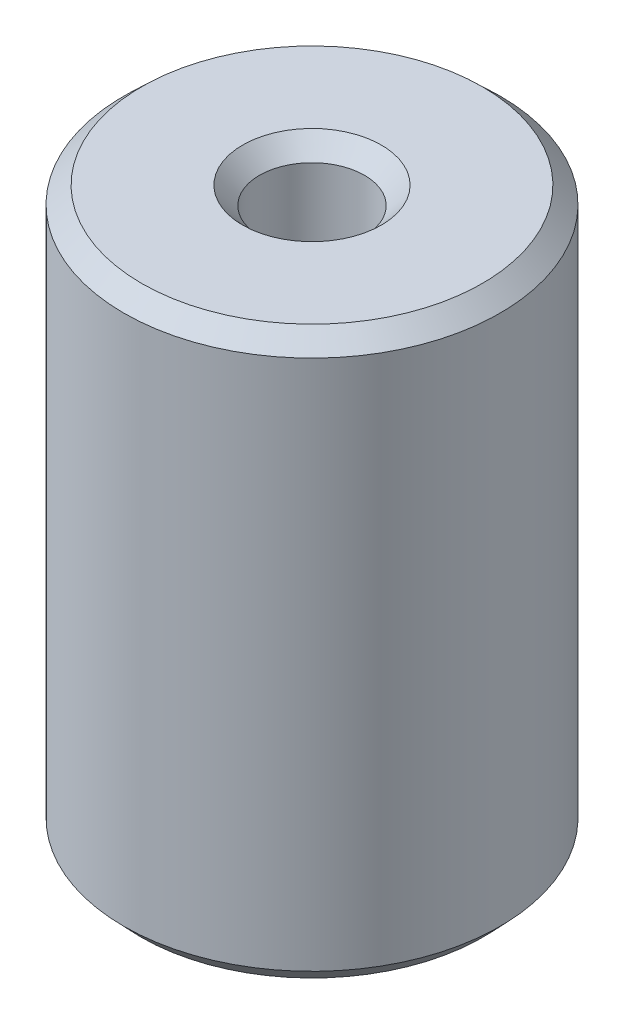
from build123d import *
from OCP.BRepFilletAPI import BRepFilletAPI_MakeChamfer

# Parameters (mm, degrees)
SKETCH1_R           = 5
BOSS_EXTRUDE1_DEPTH = 15.036214451
SKETCH2_R           = 1.395465376
CUT_EXTRUDE1_DEPTH  = 17.61588833
CHAMFER1_SIZE       = 0.448764286
CHAMFER1_SIZE2      = 0.471160481


with BuildPart() as part:
    # Sketch1 → Boss-Extrude1 (new body)
    with BuildSketch(Plane(origin=(0, 0, 0), x_dir=(1, 0, 0), z_dir=(0, 1, 0))):
        Circle(SKETCH1_R)
    extrude(amount=BOSS_EXTRUDE1_DEPTH)

    # Sketch2 → Cut-Extrude1 (cut, through all)
    with BuildSketch(Plane(origin=(0, 0, 0), x_dir=(1, 0, 0), z_dir=(0, 1, 0))):
        Circle(SKETCH2_R)
    extrude(amount=CUT_EXTRUDE1_DEPTH, mode=Mode.SUBTRACT)

    # Chamfer1: one chamfer whose edges measure the first distance from different faces: ONE call of the kernel's chamfer builder (chamfer() names one face for all edges)
    chamfer1_edges_1 = [part.edges().sort_by_distance(p)[0] for p in [
        (-1.395465376, 15.036214451, 0),
    ]]
    chamfer1_side_1 = [part.faces().sort_by_distance(p)[0] for p in [
        (-4.858578644, 15.036214451, 0),
    ]]
    chamfer1_edges_2 = [part.edges().sort_by_distance(p)[0] for p in [
        (-1.395465376, 0, 0),
    ]]
    chamfer1_side_2 = [part.faces().sort_by_distance(p)[0] for p in [
        (-1.395465376, 7.518107225, 0),
    ]]
    chamfer1_edges_3 = [part.edges().sort_by_distance(p)[0] for p in [
        (-5, 0, 0),
    ]]
    chamfer1_side_3 = [part.faces().sort_by_distance(p)[0] for p in [
        (-4.858578644, 0, 0),
    ]]
    chamfer1_edges_4 = [part.edges().sort_by_distance(p)[0] for p in [
        (-5, 15.036214451, 0),
    ]]
    chamfer1_side_4 = [part.faces().sort_by_distance(p)[0] for p in [
        (-5, 7.518107225, 0),
    ]]
    chamfer1 = BRepFilletAPI_MakeChamfer(part.part.solid().wrapped)
    for e in chamfer1_edges_1:
        chamfer1.Add(CHAMFER1_SIZE, CHAMFER1_SIZE2, e.wrapped, chamfer1_side_1[0].wrapped)  # the first distance lies on this face
    for e in chamfer1_edges_2:
        chamfer1.Add(CHAMFER1_SIZE, CHAMFER1_SIZE2, e.wrapped, chamfer1_side_2[0].wrapped)  # the first distance lies on this face
    for e in chamfer1_edges_3:
        chamfer1.Add(CHAMFER1_SIZE, CHAMFER1_SIZE2, e.wrapped, chamfer1_side_3[0].wrapped)  # the first distance lies on this face
    for e in chamfer1_edges_4:
        chamfer1.Add(CHAMFER1_SIZE, CHAMFER1_SIZE2, e.wrapped, chamfer1_side_4[0].wrapped)  # the first distance lies on this face
    add(Compound.cast(chamfer1.Shape()), mode=Mode.REPLACE)


solid = part.part
